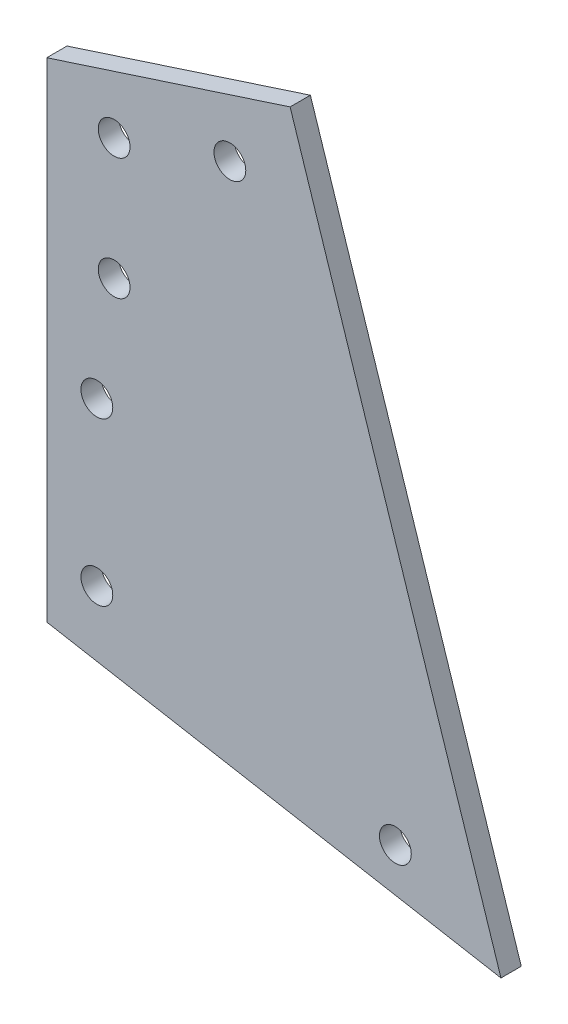
from build123d import *

# Parameters (mm, degrees)
BOSS_EXTRUDE1_DEPTH    = 3.175
F_10_CLEARANCE_HOLE1_D = 4.9784


with BuildPart() as part:
    # Sketch2 → Boss-Extrude1 (new body)
    with BuildSketch(Plane.XY):
        Polygon((75.96605069, 191.201454104), (42.954209552, 292.801454104), (4.854209552, 280.422013677), (4.854209552, 203.901454104), align=None)
    extrude(amount=BOSS_EXTRUDE1_DEPTH)

    # #10 Clearance Hole1 (through all)
    with Locations(Plane.XY.offset(3.175)):
        with Locations((33.525155133, 280.723036347), (59.435154755, 200.980257064), (12.7, 238.125), (12.7, 212.725), (15.407528498, 274.836262604), (15.407528498, 255.786262604)):
            Hole(F_10_CLEARANCE_HOLE1_D / 2)


solid = part.part
